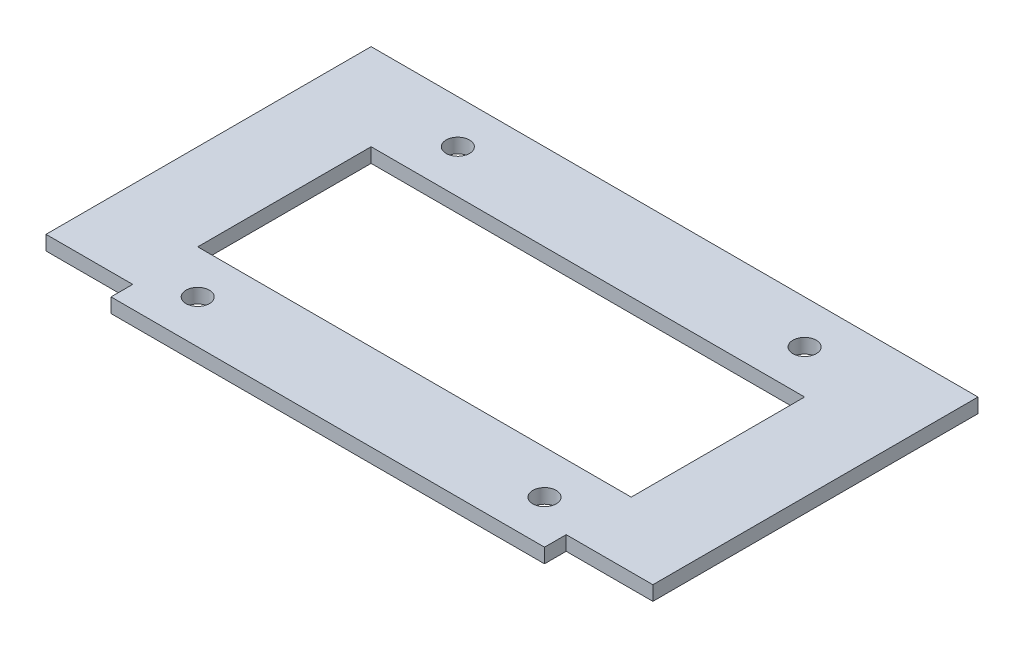
from build123d import *

# Parameters (mm, degrees)
SKETCH1_W           = 533.4
SKETCH1_H           = 304.8
BOSS_EXTRUDE1_DEPTH = 12.7
SKETCH2_W           = 381
SKETCH2_H           = 152.4
SKETCH2_W_2         = 76.2
SKETCH2_H_2         = 19.05
CUT_EXTRUDE1_DEPTH  = 12.7
SKETCH4_R           = 10.287
CUT_EXTRUDE2_DEPTH  = 12.7


with BuildPart() as part:
    # Sketch1 → Boss-Extrude1 (new body)
    with BuildSketch(Plane(origin=(0, 0, 0), x_dir=(1, 0, 0), z_dir=(0, 1, 0))):
        with Locations((207.199775418, -105.5355758)):
            Rectangle(SKETCH1_W, SKETCH1_H)
    extrude(amount=BOSS_EXTRUDE1_DEPTH)

    # Sketch2 → Cut-Extrude1 (cut)
    with BuildSketch(Plane(origin=(0, 12.7, 0), x_dir=(1, 0, 0), z_dir=(0, 1, 0))):
        with Locations((207.199775418, -105.5355758)):
            Rectangle(SKETCH2_W, SKETCH2_H)
        with Locations((435.799775418, -248.4105758)):
            Rectangle(SKETCH2_W_2, SKETCH2_H_2)
        with Locations((-21.400224582, -248.4105758)):
            Rectangle(SKETCH2_W_2, SKETCH2_H_2)
    extrude(amount=-CUT_EXTRUDE1_DEPTH, mode=Mode.SUBTRACT)

    # Sketch4 → Cut-Extrude2 (cut)
    with BuildSketch(Plane(origin=(0, 12.7, 0), x_dir=(1, 0, 0), z_dir=(0, 1, 0))):
        with Locations((54.799775418, 8.7644242)):
            Circle(SKETCH4_R)
        with Locations((359.599775418, 8.7644242)):
            Circle(SKETCH4_R)
        with Locations((54.799775418, -219.8355758)):
            Circle(SKETCH4_R)
        with Locations((359.599775418, -219.8355758)):
            Circle(SKETCH4_R)
    extrude(amount=-CUT_EXTRUDE2_DEPTH, mode=Mode.SUBTRACT)


solid = part.part
